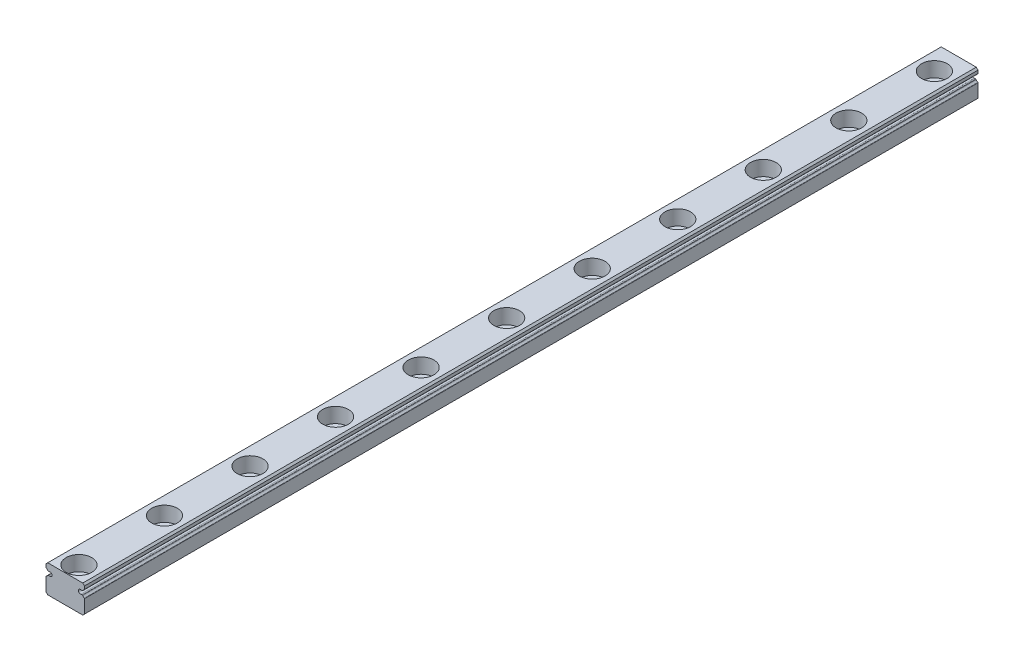
from build123d import *

# Parameters (mm, degrees)
BOSS_EXTRUDE1_DEPTH = 208.9
SKETCH2_R           = 3
CUT_EXTRUDE1_DEPTH  = 3.5
SKETCH3_R           = 1.75
CUT_EXTRUDE2_DEPTH  = 209.977773938


with BuildPart() as part:
    # Sketch1 → Boss-Extrude1 (new body)
    with BuildSketch(Plane.XY):
        with BuildLine():
            Line((-4.1, 6.5), (-4.5, 6.1))
            Line((-4.5, 6.1), (-4.5, 5.411997899))
            ThreePointArc((-4.5, 5.411997899), (-4.481535993, 5.345216747), (-4.431388889, 5.297405559))
            ThreePointArc((-4.431388889, 5.297405559), (-4.224528747, 5.147646302), (-4.065036084, 4.948194444))
            ThreePointArc((-4.065036084, 4.948194444), (-4.01760557, 4.901896679), (-3.953514706, 4.885))
            Line((-3.953514706, 4.885), (-3.688448805, 4.885))
            ThreePointArc((-3.688448805, 4.885), (-3.669364148, 4.886408492), (-3.650693039, 4.890603448))
            ThreePointArc((-3.650693039, 4.890603448), (-3.07, 4.46), (-3.650693039, 4.029396552))
            ThreePointArc((-3.650693039, 4.029396552), (-3.669364148, 4.033591508), (-3.688448805, 4.035))
            Line((-3.688448805, 4.035), (-3.953514706, 4.035))
            ThreePointArc((-3.953514706, 4.035), (-4.01760557, 4.018103321), (-4.065036084, 3.971805556))
            ThreePointArc((-4.065036084, 3.971805556), (-4.224528747, 3.772353698), (-4.431388889, 3.622594441))
            ThreePointArc((-4.431388889, 3.622594441), (-4.481535993, 3.574783253), (-4.5, 3.508002101))
            Line((-4.5, 3.508002101), (-4.5, 0.4))
            Line((-4.5, 0.4), (-4.1, 0))
            Line((-4.1, 0), (4.1, 0))
            Line((4.1, 0), (4.5, 0.4))
            Line((4.5, 0.4), (4.5, 3.508002101))
            ThreePointArc((4.5, 3.508002101), (4.481535993, 3.574783253), (4.431388889, 3.622594441))
            ThreePointArc((4.431388889, 3.622594441), (4.224528747, 3.772353698), (4.065036084, 3.971805556))
            ThreePointArc((4.065036084, 3.971805556), (4.01760557, 4.018103321), (3.953514706, 4.035))
            Line((3.953514706, 4.035), (3.688448805, 4.035))
            ThreePointArc((3.688448805, 4.035), (3.669364148, 4.033591508), (3.650693039, 4.029396552))
            ThreePointArc((3.650693039, 4.029396552), (3.07, 4.46), (3.650693039, 4.890603448))
            ThreePointArc((3.650693039, 4.890603448), (3.669364148, 4.886408492), (3.688448805, 4.885))
            Line((3.688448805, 4.885), (3.953514706, 4.885))
            ThreePointArc((3.953514706, 4.885), (4.01760557, 4.901896679), (4.065036084, 4.948194444))
            ThreePointArc((4.065036084, 4.948194444), (4.224528747, 5.147646302), (4.431388889, 5.297405559))
            ThreePointArc((4.431388889, 5.297405559), (4.481535993, 5.345216747), (4.5, 5.411997899))
            Line((4.5, 5.411997899), (4.5, 6.1))
            Line((4.5, 6.1), (4.1, 6.5))
            Line((4.1, 6.5), (-4.1, 6.5))
        make_face()
    extrude(amount=BOSS_EXTRUDE1_DEPTH)

    # Sketch2 → Cut-Extrude1 (cut)
    with BuildSketch(Plane(origin=(0, 6.5, 0), x_dir=(1, 0, 0), z_dir=(0, 1, 0))):
        with Locations((0, -205.7)):
            Circle(SKETCH2_R)
        with Locations((0, -185.7)):
            Circle(SKETCH2_R)
        with Locations((0, -165.7)):
            Circle(SKETCH2_R)
        with Locations((0, -145.7)):
            Circle(SKETCH2_R)
        with Locations((0, -125.7)):
            Circle(SKETCH2_R)
        with Locations((0, -105.7)):
            Circle(SKETCH2_R)
        with Locations((0, -85.7)):
            Circle(SKETCH2_R)
        with Locations((0, -65.7)):
            Circle(SKETCH2_R)
        with Locations((0, -45.7)):
            Circle(SKETCH2_R)
        with Locations((0, -25.7)):
            Circle(SKETCH2_R)
        with Locations((0, -5.7)):
            Circle(SKETCH2_R)
    extrude(amount=-CUT_EXTRUDE1_DEPTH, mode=Mode.SUBTRACT)

    # Sketch3 → Cut-Extrude2 (cut, through all)
    with BuildSketch(Plane(origin=(0, 3, 0), x_dir=(1, 0, 0), z_dir=(0, 1, 0))):
        with Locations((0, -205.7)):
            Circle(SKETCH3_R)
        with Locations((0, -185.7)):
            Circle(SKETCH3_R)
        with Locations((0, -165.7)):
            Circle(SKETCH3_R)
        with Locations((0, -145.7)):
            Circle(SKETCH3_R)
        with Locations((0, -125.7)):
            Circle(SKETCH3_R)
        with Locations((0, -105.7)):
            Circle(SKETCH3_R)
        with Locations((0, -85.7)):
            Circle(SKETCH3_R)
        with Locations((0, -65.7)):
            Circle(SKETCH3_R)
        with Locations((0, -45.7)):
            Circle(SKETCH3_R)
        with Locations((0, -25.7)):
            Circle(SKETCH3_R)
        with Locations((0, -5.7)):
            Circle(SKETCH3_R)
        with Locations((0, 14.3)):
            Circle(SKETCH3_R)
    extrude(amount=-CUT_EXTRUDE2_DEPTH, mode=Mode.SUBTRACT)


solid = part.part
